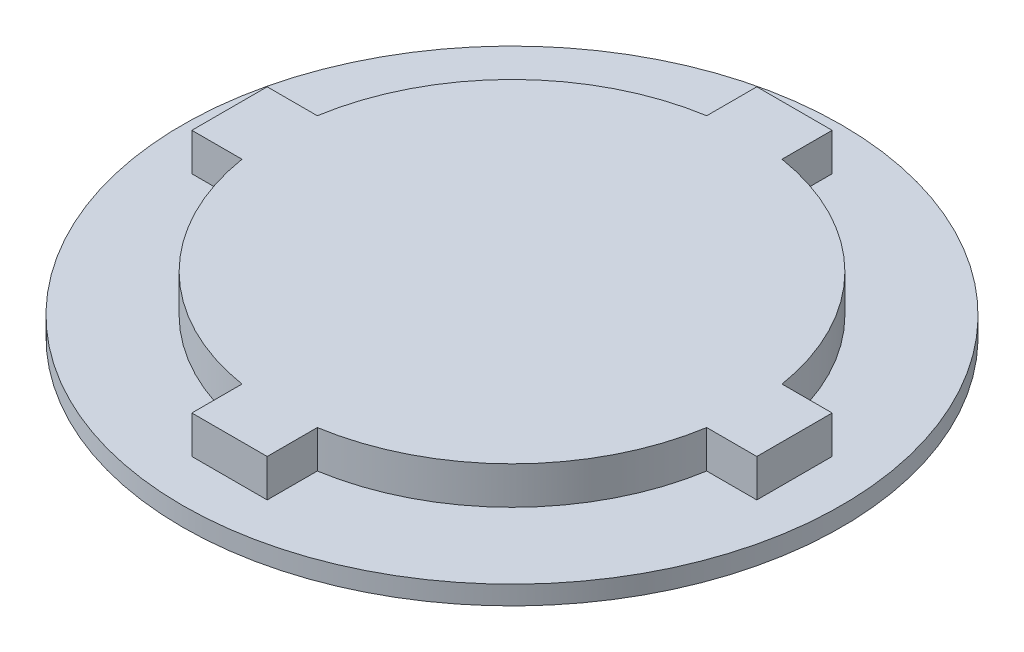
from build123d import *

# Parameters (mm, degrees)
CROQUIS5_R              = 25
SALIENTE_EXTRUIR3_DEPTH = 4
SALIENTE_EXTRUIR4_DEPTH = 4
CROQUIS7_R              = 35
SALIENTE_EXTRUIR5_DEPTH = 2


with BuildPart() as part:
    # Croquis5 → Saliente-Extruir3 (new body)
    with BuildSketch(Plane(origin=(0, 0, 0), x_dir=(1, 0, 0), z_dir=(0, 1, 0))):
        Circle(CROQUIS5_R)
    extrude(amount=SALIENTE_EXTRUIR3_DEPTH)

    # Croquis6 → Saliente-Extruir4 (add)
    with BuildSketch(Plane.XZ):
        with BuildLine():
            Line((-4, -30), (4, -30))
            Line((4, -30), (4, -24.677925359))
            ThreePointArc((4, -24.677925359), (0, -25), (-4, -24.677925359))
            Line((-4, -24.677925359), (-4, -30))
        make_face()
        with BuildLine():
            ThreePointArc((24.677925359, 4), (25, 0), (24.677925359, -4))
            Line((24.677925359, -4), (30, -4))
            Line((30, -4), (30, 4))
            Line((30, 4), (24.677925359, 4))
        make_face()
        with BuildLine():
            Line((-30, -4), (-24.677925359, -4))
            ThreePointArc((-24.677925359, -4), (-25, 0), (-24.677925359, 4))
            Line((-24.677925359, 4), (-30, 4))
            Line((-30, 4), (-30, -4))
        make_face()
        with BuildLine():
            ThreePointArc((-4, 24.677925359), (0, 25), (4, 24.677925359))
            Line((4, 24.677925359), (4, 30))
            Line((4, 30), (-4, 30))
            Line((-4, 30), (-4, 24.677925359))
        make_face()
    extrude(amount=-SALIENTE_EXTRUIR4_DEPTH)

    # Croquis7 → Saliente-Extruir5 (add)
    with BuildSketch(Plane.XZ):
        Circle(CROQUIS7_R)
    extrude(amount=SALIENTE_EXTRUIR5_DEPTH)


solid = part.part
